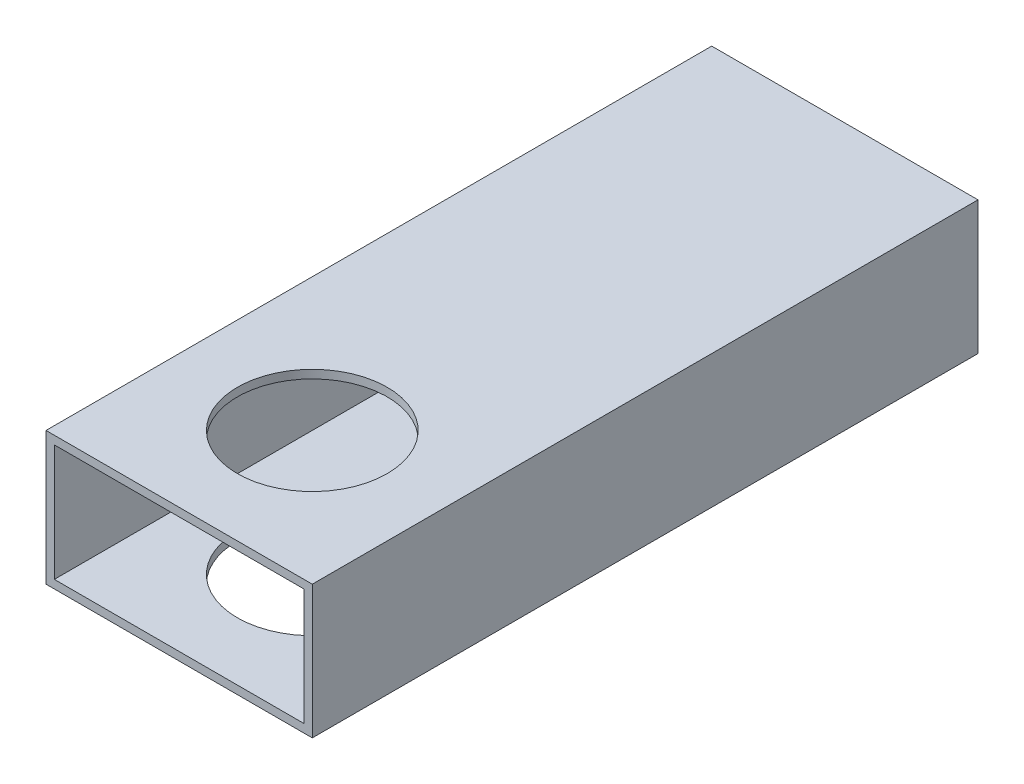
from build123d import *

# Parameters (mm, degrees)
SKETCH1_W           = 50.8
SKETCH1_H           = 25.4
SKETCH1_W_2         = 47.625
SKETCH1_H_2         = 22.225
BOSS_EXTRUDE1_DEPTH = 127
SKETCH2_R           = 14.2875
CUT_EXTRUDE1_DEPTH  = 132.982271537


with BuildPart() as part:
    # Sketch1 → Boss-Extrude1 (new body)
    with BuildSketch(Plane.XY):
        Rectangle(SKETCH1_W, SKETCH1_H)
        Rectangle(SKETCH1_W_2, SKETCH1_H_2, mode=Mode.SUBTRACT)
    extrude(amount=BOSS_EXTRUDE1_DEPTH)

    # Sketch2 → Cut-Extrude1 (cut, through all)
    with BuildSketch(Plane.XZ.offset(12.7)):
        with Locations((0, 101.6)):
            Circle(SKETCH2_R)
    extrude(amount=-CUT_EXTRUDE1_DEPTH, mode=Mode.SUBTRACT)


solid = part.part
